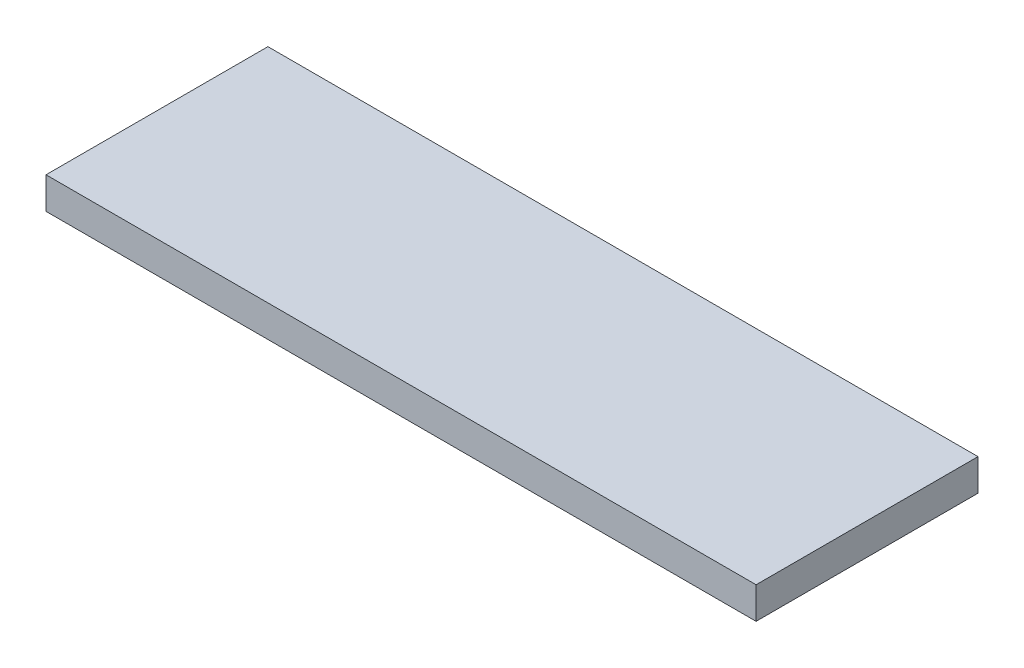
from build123d import *

# Parameters (mm, degrees)
SKETCH_2_W      = 224
SKETCH_2_H      = 70
EXTRUDE_1_DEPTH = 10


with BuildPart() as part:
    # 草图2 → 凸台-拉伸1 (new body)
    with BuildSketch(Plane(origin=(0, 0, 0), x_dir=(1, 0, 0), z_dir=(0, 1, 0))):
        Rectangle(SKETCH_2_W, SKETCH_2_H)
    extrude(amount=EXTRUDE_1_DEPTH)


solid = part.part
